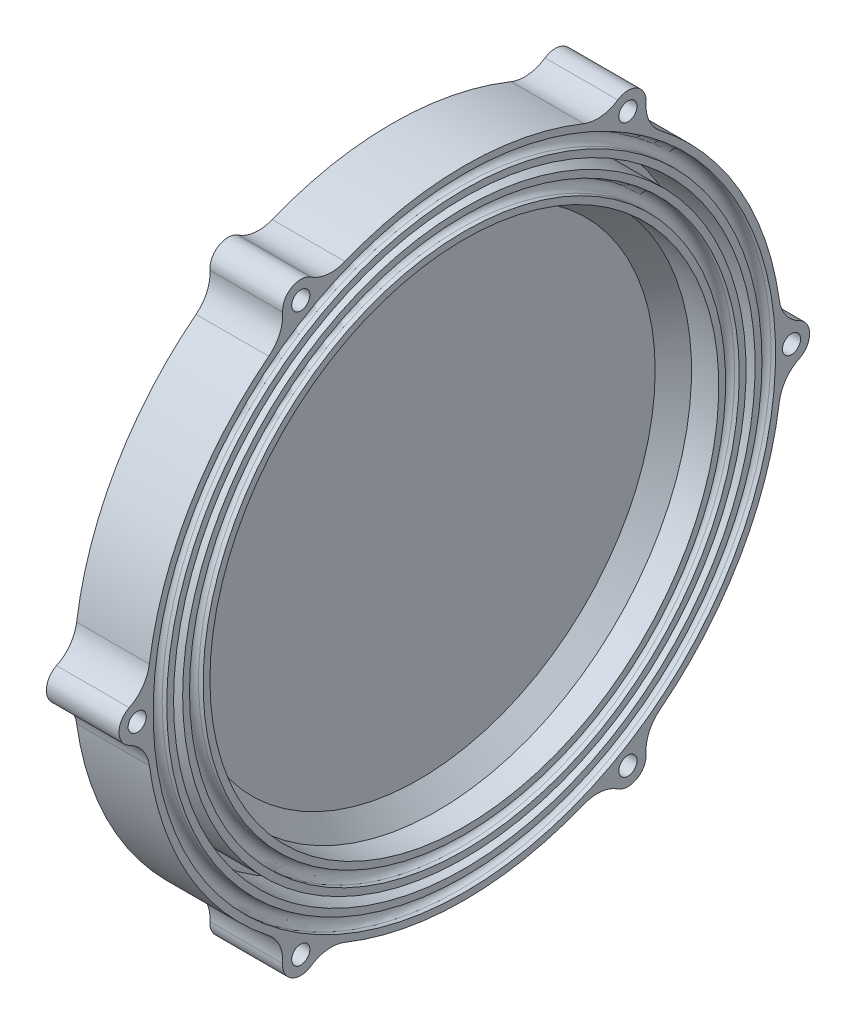
from build123d import *

# Parameters (mm, degrees)
BOSS_EXTRUDE1_START     = -25.4
SKETCH3_R               = 3.175
BOSS_EXTRUDE1_DEPTH     = 25.4
CIRPATTERN1_OUTLINE_R   = 3.175
CIRPATTERN1_OUTLINE_R_2 = 101.6
CIRPATTERN1_DEPTH       = 25.4


with BuildPart() as part:
    # Sketch1 → Revolve1 (revolve)
    with BuildSketch(Plane.XY, mode=Mode.PRIVATE) as revolve1_sk:
        Polygon((0, 111.125), (0, 0), (9.525, 0), (9.525, 82.55), (15.875, 88.9), (25.4, 88.9), (25.4, 98.425), (6.35, 98.425), (6.35, 101.6), (25.4, 101.6), (25.4, 111.125), align=None)
    revolve(revolve1_sk.sketch.rotate(Axis((0, 0, 0), (1, 0, 0)), 90), axis=Axis((0, 0, 0), (1, 0, 0)))

    # Sketch3 → Boss-Extrude1 (add)
    # profile 1 of 3: a face of its own
    with BuildSketch(Plane(origin=(25.4, 0, 0), x_dir=(0, 0, -1), z_dir=(1, 0, 0)).offset(BOSS_EXTRUDE1_START)):
        with BuildLine():
            ThreePointArc((-110.992708333, 5.420730747), (-113.998455884, 6.342836207), (-117.078125, 5.710036907))
            ThreePointArc((-117.078125, 5.710036907), (-120.65, 0), (-117.078125, -5.710036907))
            ThreePointArc((-117.078125, -5.710036907), (-113.998455884, -6.342836207), (-110.992708333, -5.420730747))
            ThreePointArc((-110.992708333, -5.420730747), (-111.09192216, -2.71117239), (-111.125, 0))
            ThreePointArc((-111.125, 0), (-111.09192216, 2.71117239), (-110.992708333, 5.420730747))
        make_face()
        with Locations((-114.3, 0)):
            Circle(SKETCH3_R, mode=Mode.SUBTRACT)
    # profile 2 of 3: a face of its own
    with BuildSketch(Plane(origin=(25.4, 0, 0), x_dir=(0, 0, -1), z_dir=(1, 0, 0)).offset(BOSS_EXTRUDE1_START)):
        with BuildLine():
            ThreePointArc((-110.056490385, 15.373176289), (-112.36034097, 9.664574924), (-117.078125, 5.710036907))
            ThreePointArc((-117.078125, 5.710036907), (-113.998455884, 6.342836207), (-110.992708333, 5.420730747))
            ThreePointArc((-110.992708333, 5.420730747), (-110.636566543, 10.407486174), (-110.056490385, 15.373176289))
        make_face()
    # profile 3 of 3: a face of its own
    with BuildSketch(Plane(origin=(25.4, 0, 0), x_dir=(0, 0, -1), z_dir=(1, 0, 0)).offset(BOSS_EXTRUDE1_START)):
        with BuildLine():
            ThreePointArc((-110.992708333, -5.420730747), (-113.998455884, -6.342836207), (-117.078125, -5.710036907))
            ThreePointArc((-117.078125, -5.710036907), (-112.36034097, -9.664574924), (-110.056490385, -15.373176289))
            ThreePointArc((-110.056490385, -15.373176289), (-110.636566543, -10.407486174), (-110.992708333, -5.420730747))
        make_face()
    extrude(amount=BOSS_EXTRUDE1_DEPTH)

    # CirPattern1: read off the stored shape, not the designer's step
    # CirPattern1 outline → CirPattern1 (add)
    with BuildSketch(Plane.YZ):
        with BuildLine():
            ThreePointArc((-5.710036907, 117.078125), (-9.664574924, 112.36034097), (-15.373176289, 110.056490385))
            ThreePointArc((-15.373176289, 110.056490385), (-55.5625, 96.237072996), (-87.62512838, 68.341806396))
            ThreePointArc((-87.62512838, 68.341806396), (-92.474622196, 64.549937886), (-98.537612024, 63.484099518))
            ThreePointArc((-98.537612024, 63.484099518), (-104.485964967, 60.325), (-104.247648931, 53.594025482))
            ThreePointArc((-104.247648931, 53.594025482), (-102.13919712, 47.810403084), (-102.998304669, 41.714683989))
            ThreePointArc((-102.998304669, 41.714683989), (-111.125, 0), (-102.998304669, -41.714683989))
            ThreePointArc((-102.998304669, -41.714683989), (-102.13919712, -47.810403084), (-104.247648931, -53.594025482))
            ThreePointArc((-104.247648931, -53.594025482), (-104.485964967, -60.325), (-98.537612024, -63.484099518))
            ThreePointArc((-98.537612024, -63.484099518), (-92.474622196, -64.549937886), (-87.62512838, -68.341806396))
            ThreePointArc((-87.62512838, -68.341806396), (-55.5625, -96.237072996), (-15.373176289, -110.056490385))
            ThreePointArc((-15.373176289, -110.056490385), (-9.664574924, -112.36034097), (-5.710036907, -117.078125))
            ThreePointArc((-5.710036907, -117.078125), (0, -120.65), (5.710036907, -117.078125))
            ThreePointArc((5.710036907, -117.078125), (9.664574924, -112.36034097), (15.373176289, -110.056490385))
            ThreePointArc((15.373176289, -110.056490385), (55.5625, -96.237072996), (87.62512838, -68.341806396))
            ThreePointArc((87.62512838, -68.341806396), (92.474622196, -64.549937886), (98.537612024, -63.484099518))
            ThreePointArc((98.537612024, -63.484099518), (104.485964967, -60.325), (104.247648931, -53.594025482))
            ThreePointArc((104.247648931, -53.594025482), (102.13919712, -47.810403084), (102.998304669, -41.714683989))
            ThreePointArc((102.998304669, -41.714683989), (111.125, 0), (102.998304669, 41.714683989))
            ThreePointArc((102.998304669, 41.714683989), (102.13919712, 47.810403084), (104.247648931, 53.594025482))
            ThreePointArc((104.247648931, 53.594025482), (104.485964967, 60.325), (98.537612024, 63.484099518))
            ThreePointArc((98.537612024, 63.484099518), (92.474622196, 64.549937886), (87.62512838, 68.341806396))
            ThreePointArc((87.62512838, 68.341806396), (55.5625, 96.237072996), (15.373176289, 110.056490385))
            ThreePointArc((15.373176289, 110.056490385), (9.664574924, 112.36034097), (5.710036907, 117.078125))
            ThreePointArc((5.710036907, 117.078125), (0, 120.65), (-5.710036907, 117.078125))
        make_face()
        with Locations((-98.986703653, -57.15)):
            Circle(CIRPATTERN1_OUTLINE_R, mode=Mode.SUBTRACT)
        with Locations((0, -114.3)):
            Circle(CIRPATTERN1_OUTLINE_R, mode=Mode.SUBTRACT)
        with Locations((98.986703653, -57.15)):
            Circle(CIRPATTERN1_OUTLINE_R, mode=Mode.SUBTRACT)
        with Locations((-98.986703653, 57.15)):
            Circle(CIRPATTERN1_OUTLINE_R, mode=Mode.SUBTRACT)
        Circle(CIRPATTERN1_OUTLINE_R_2, mode=Mode.SUBTRACT)
        with Locations((98.986703653, 57.15)):
            Circle(CIRPATTERN1_OUTLINE_R, mode=Mode.SUBTRACT)
        with Locations((0, 114.3)):
            Circle(CIRPATTERN1_OUTLINE_R, mode=Mode.SUBTRACT)
    extrude(amount=CIRPATTERN1_DEPTH)

    # Cut-Sweep1: sweep along a path in Sketch4
    with BuildLine(Plane(origin=(25.4, 0, 0), x_dir=(0, 0, -1), z_dir=(1, 0, 0))) as cut_sweep1_path:
        CenterArc((0, 0), 106.3625, 0, 360)
    # Sketch6 → Cut-Sweep1 (sweep, cut)
    with BuildSketch(Plane.XY):
        with BuildLine():
            Line((23.8125, 108.74375), (26.19375, 108.74375))
            Line((26.19375, 108.74375), (26.19375, 103.98125))
            Line((26.19375, 103.98125), (23.8125, 103.98125))
            ThreePointArc((23.8125, 103.98125), (21.43125, 106.3625), (23.8125, 108.74375))
        make_face()
        with BuildLine():
            Line((23.8125, 91.28125), (26.19375, 91.28125))
            Line((26.19375, 91.28125), (26.19375, 96.04375))
            Line((26.19375, 96.04375), (23.8125, 96.04375))
            ThreePointArc((23.8125, 96.04375), (21.43125, 93.6625), (23.8125, 91.28125))
        make_face()
    sweep(path=cut_sweep1_path.line, mode=Mode.SUBTRACT)


solid = part.part
